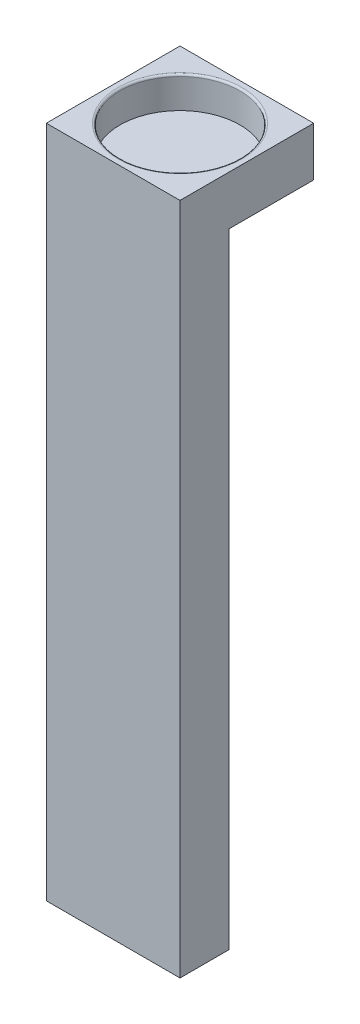
from build123d import *

# Parameters (mm, degrees)
SKETCH1_W           = 13.6
SKETCH1_H           = 13.6
BOSS_EXTRUDE1_DEPTH = 5
SKETCH2_R           = 6.1
CUT_EXTRUDE1_DEPTH  = 3.2
SKETCH3_W           = 13.6
SKETCH3_H           = 5
BOSS_EXTRUDE2_DEPTH = 63.5
FILLET1_R           = 0.2


with BuildPart() as part:
    # Sketch1 → Boss-Extrude1 (new body)
    with BuildSketch(Plane(origin=(0, 0, 0), x_dir=(1, 0, 0), z_dir=(0, 1, 0))):
        Rectangle(SKETCH1_W, SKETCH1_H)
    extrude(amount=BOSS_EXTRUDE1_DEPTH)

    # Sketch2 → Cut-Extrude1 (cut)
    with BuildSketch(Plane(origin=(0, 5, 0), x_dir=(1, 0, 0), z_dir=(0, 1, 0))):
        Circle(SKETCH2_R)
    extrude(amount=-CUT_EXTRUDE1_DEPTH, mode=Mode.SUBTRACT)

    # Sketch3 → Boss-Extrude2 (add)
    with BuildSketch(Plane.XZ):
        with Locations((0, 4.3)):
            Rectangle(SKETCH3_W, SKETCH3_H)
    extrude(amount=BOSS_EXTRUDE2_DEPTH)

    # Fillet1
    fillet1_edges = [part.edges().sort_by_distance(p)[0] for p in [
        (-6.1, 5, 0),
    ]]
    fillet(fillet1_edges, radius=FILLET1_R)


solid = part.part
